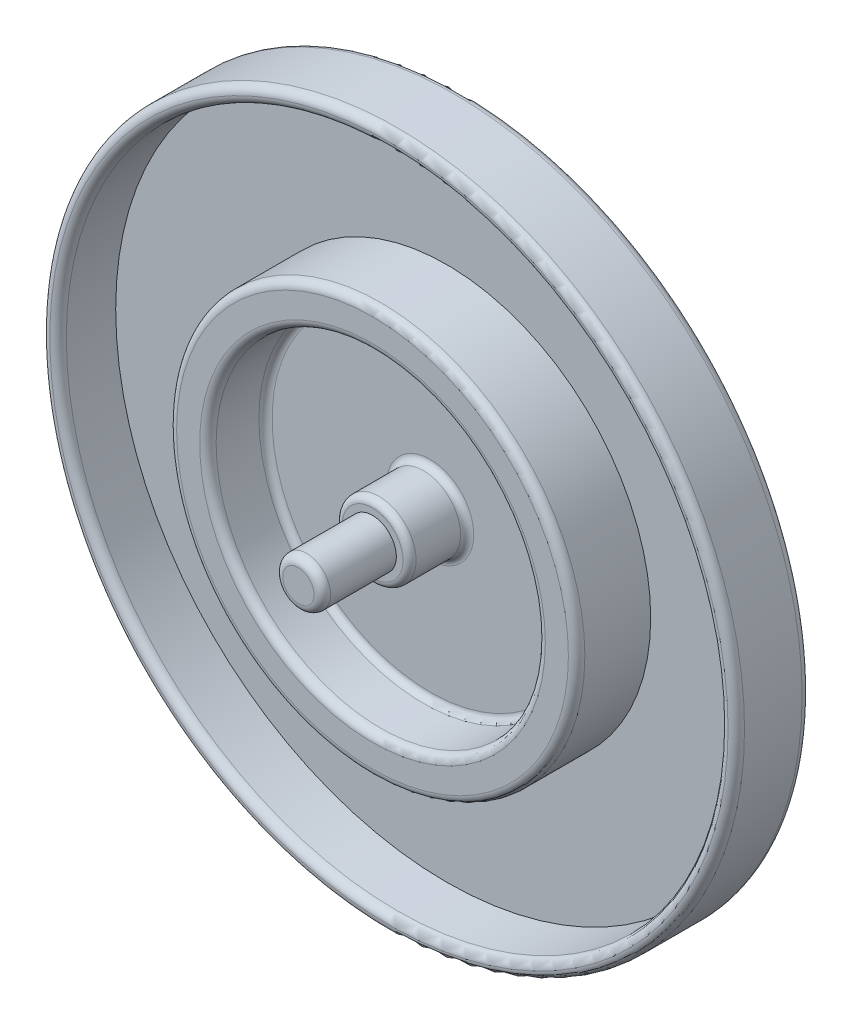
from build123d import *

# Parameters (mm, degrees)
SKETCH1_R             = 12.4
SKETCH1_R_2           = 10
BOSS_EXTRUDE1_DEPTH   = 4.5
SKETCH1_R_3           = 21.1
SKETCH1_R_4           = 20.1
BOSS_EXTRUDE1_2_DEPTH = 4.5
SKETCH6_R             = 21.1
SKETCH6_R_2           = 20.1
CUT_EXTRUDE1_DEPTH    = 1
SKETCH2_R             = 21.1
BOSS_EXTRUDE2_DEPTH   = 1
SKETCH3_R             = 1.45
BOSS_EXTRUDE3_DEPTH   = 9
FILLET1_R             = 0.5
SKETCH4_R             = 10
BOSS_EXTRUDE4_DEPTH   = 1
SKETCH5_R             = 2.25
BOSS_EXTRUDE5_DEPTH   = 3.5
FILLET2_R             = 0.4


with BuildPart() as part:
    # Sketch1 → Boss-Extrude1 (new body)
    with BuildSketch(Plane.XY):
        Circle(SKETCH1_R)
        Circle(SKETCH1_R_2, mode=Mode.SUBTRACT)
    extrude(amount=BOSS_EXTRUDE1_DEPTH)



with BuildPart() as body_2:
    # Sketch1 → Boss-Extrude1 2 (new body)
    with BuildSketch(Plane.XY):
        Circle(SKETCH1_R_3)
        Circle(SKETCH1_R_4, mode=Mode.SUBTRACT)
    extrude(amount=BOSS_EXTRUDE1_2_DEPTH)

    # Sketch6 → Cut-Extrude1 (cut)
    with BuildSketch(Plane.XY.offset(4.5)):
        Circle(SKETCH6_R)
        Circle(SKETCH6_R_2, mode=Mode.SUBTRACT)
    extrude(amount=-CUT_EXTRUDE1_DEPTH, mode=Mode.SUBTRACT)


with BuildPart() as part_1:
    add(part.part)

    add(body_2.part)  # Boss-Extrude2 merges body 2
    # Sketch2 → Boss-Extrude2 (add)
    with BuildSketch(Plane(origin=(0, 0, 0), x_dir=(-1, 0, 0), z_dir=(0, 0, -1))):
        with Locations(Location((0, 0, 0), (0, 0, 180))):
            Circle(SKETCH2_R)
    extrude(amount=BOSS_EXTRUDE2_DEPTH)

    # Sketch3 → Boss-Extrude3 (add)
    with BuildSketch(Plane.XY):
        with Locations(Location((0, 0, 0), (0, 0, 180))):
            Circle(SKETCH3_R)
    extrude(amount=BOSS_EXTRUDE3_DEPTH)

    # Fillet1
    fillet1_edges = [part_1.edges().sort_by_distance(p)[0] for p in [
        (-12.4, 0, 4.5),
        (-21.1, 0, -1),
        (-20.1, 0, 3.5),
        (-21.1, 0, 3.5),
        (1.45, 0, 9),
        (-10, 0, 4.5),
    ]]
    fillet(fillet1_edges, radius=FILLET1_R - 0.0001)  # a hair under: the kernel refuses the full size

    # Sketch4 → Boss-Extrude4 (add)
    with BuildSketch(Plane.XY):
        Circle(SKETCH4_R)
    extrude(amount=BOSS_EXTRUDE4_DEPTH)

    # Sketch5 → Boss-Extrude5 (add)
    with BuildSketch(Plane.XY.offset(1)):
        Circle(SKETCH5_R)
    extrude(amount=BOSS_EXTRUDE5_DEPTH)

    # Fillet2
    fillet2_edges = [part_1.edges().sort_by_distance(p)[0] for p in [
        (-10, 0, 1),
        (-2.25, 0, 1),
        (-2.25, 0, 4.5),
    ]]
    fillet(fillet2_edges, radius=FILLET2_R)


solid = part_1.part
